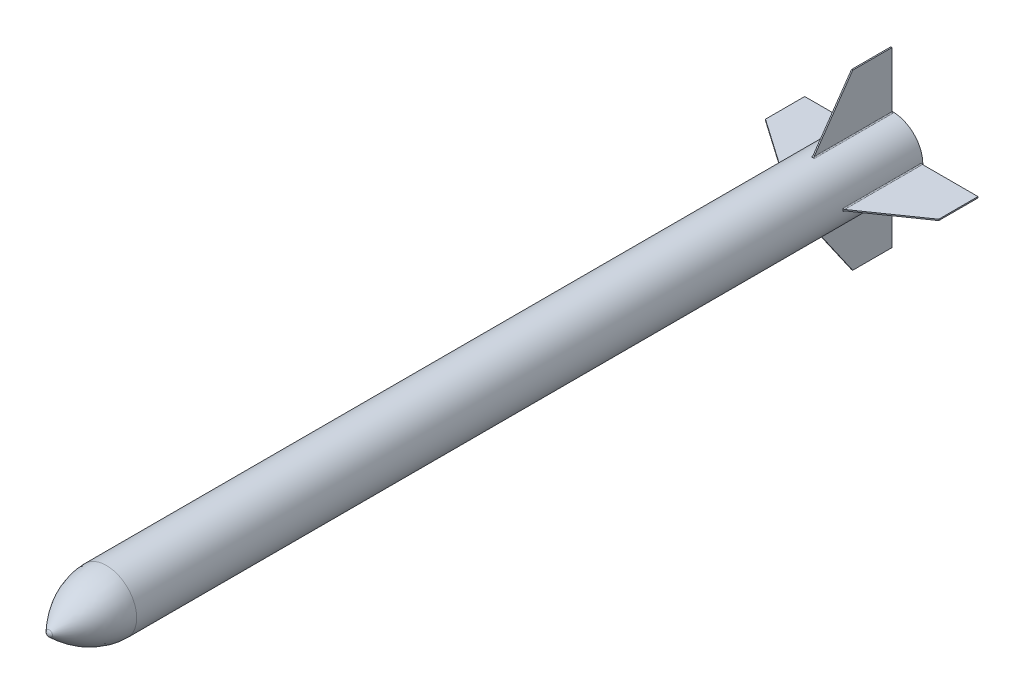
from build123d import *

# Parameters (mm, degrees)
SKETCH3_R                = 43.942
BOSS_EXTRUDE1_DEPTH      = 15.24
BOSS_EXTRUDE2_REACH      = 2235.699
BOSS_EXTRUDE2_END_RADIUS = 78.32293196
SKETCH4_W                = 3.175
SKETCH4_H                = 203.2
CUT_EXTRUDE1_REACH       = 2225.452
FILLET1_R                = 2.54
CIRPATTERN1_COUNT        = 4
FILLET1_OF_CIRPATTERN1_R = 2.54


with BuildPart() as part:
    # Sketch2 → Revolve1 (revolve)
    with BuildSketch(Plane(origin=(0, 0, 0), x_dir=(0, 0, -1), z_dir=(1, 0, 0))):
        with BuildLine():
            Line((156.718, 78.322932), (2192.2105, 78.322932))
            Line((2192.2105, 78.322932), (2192.2105, 4e-08))
            Line((2192.2105, 4e-08), (4.964740615, 4e-08))
            ThreePointArc((4.964740615, 4e-08), (5.897622526, 4.522765989), (8.543990278, 8.307263076))
            add(Edge.make_bspline(
                [(8.543990278, 8.307263076), (82.630995139, 78.322932), (156.718, 78.322932)],
                knots=[0.068626342, 0.068626342, 0.068626342, 0.915329667, 0.915329667, 0.915329667], degree=2))
        make_face()
    revolve(axis=Axis((0, 4e-08, -2192.2105), (0, 0, 1)))

    # Sketch3 → Boss-Extrude1 (add)
    with BuildSketch(Plane(origin=(0, 0, -2192.2105), x_dir=(-1, 0, 0), z_dir=(0, 0, -1))):
        with Locations(Location((0, 0, 0), (0, 0, 270))):
            Circle(SKETCH3_R)
    extrude(amount=BOSS_EXTRUDE1_DEPTH)

    # Boss-Extrude2: up to this cylinder (the profile starts outside it)
    boss_extrude2_end = Plane(origin=(0, 4e-08, -2087.4355), z_dir=(0, 0, -1)) * Cylinder(BOSS_EXTRUDE2_END_RADIUS, 4629.043863919, mode=Mode.PRIVATE)
    # Sketch4 → Boss-Extrude2 (add, up to the surface)
    with BuildSketch(Plane(origin=(0, 254, 0), x_dir=(1, 0, 0), z_dir=(0, 1, 0)), mode=Mode.PRIVATE) as boss_extrude2_sk1:
        with Locations((0, 2087.4355)):
            Rectangle(SKETCH4_W, SKETCH4_H)
    boss_extrude2_tool1 = extrude(boss_extrude2_sk1.sketch, amount=-BOSS_EXTRUDE2_REACH, mode=Mode.PRIVATE) - boss_extrude2_end
    boss_extrude2 = boss_extrude2_tool1.solids().sort_by_distance((0, 254, -2087.4355))[0]
    add(boss_extrude2)

    # Sketch5 → Cut-Extrude1 (cut, up to next)
    with BuildSketch(Plane.ZY.offset(1.5875), mode=Mode.PRIVATE) as cut_extrude1_sk1:
        Polygon((-2189.0355, 224.356842107), (-2087.4355, 224.356842107), (-1985.8355, 78.306842107), (-1985.8355, 254), (-2189.0355, 254), align=None)
    cut_extrude1_tool1 = extrude(cut_extrude1_sk1.sketch, amount=-CUT_EXTRUDE1_REACH, mode=Mode.PRIVATE) & part.part
    cut_extrude1 = cut_extrude1_tool1.solids().sort_by_distance((-1.5875, 204.128915, -2050.052252))[0]
    add(cut_extrude1, mode=Mode.SUBTRACT)

    # Fillet1
    # the kernel refuses this fillet: 2.54 mm, written as the material it adds along each edge
    with BuildSketch(Plane(origin=(-1.5875, 78.306842107, -1979.708797857), x_dir=(-0.9993639751492599, -0.03566013423796214, 0), z_dir=(0, 0, -1))) as fillet1_piece_1_section:
        with BuildLine():
            CenterArc((2.450992889, 2.539698904), FILLET1_R, 182.043608469, 87.074170623)
            Line((-0.087391608, 2.449122163), (0, 0))
            ThreePointArc((0, 0), (1.205942189, 0.009284527), (2.411884379, 0))
        make_face()
    fillet1_piece_1 = extrude(amount=209.326702143, mode=Mode.PRIVATE)
    fillet1_piece_1 = split(fillet1_piece_1, bisect_by=Plane(origin=(-3.095055571, 78.248638535, -1985.795010558), z_dir=(0, -0.5710644881985977, -0.8209052017854886)), keep=Keep.TOP, mode=Mode.PRIVATE)
    add(fillet1_piece_1)
    with BuildSketch(Plane(origin=(1.5875, 78.306842107, -1979.708797857), x_dir=(0.9993639751492599, -0.035660134237962375, 0), z_dir=(0, 0, -1))) as fillet1_piece_2_section:
        with BuildLine():
            CenterArc((2.450992889, -2.539698904), FILLET1_R, 90.882220908, 87.074170623)
            Line((-0.087391608, -2.449122163), (0, 0))
            ThreePointArc((0, 0), (1.205942189, -0.009284527), (2.411884379, 0))
        make_face()
    fillet1_piece_2 = extrude(amount=209.326702143, mode=Mode.PRIVATE)
    fillet1_piece_2 = split(fillet1_piece_2, bisect_by=Plane(origin=(3.095055571, 78.248638535, -1985.795010558), z_dir=(0, -0.5710644881985977, -0.8209052017854886)), keep=Keep.TOP, mode=Mode.PRIVATE)
    add(fillet1_piece_2)

    # CirPattern1: Boss-Extrude2, Cut-Extrude1 ×4 about axis
    cirpattern1_axis = Axis((0, 1.7e-08, 0), (0, 0, 1))
    add([boss_extrude2.rotate(cirpattern1_axis, i * 360 / CIRPATTERN1_COUNT) for i in range(1, CIRPATTERN1_COUNT)])
    add([cut_extrude1.rotate(cirpattern1_axis, i * 360 / CIRPATTERN1_COUNT) for i in range(1, CIRPATTERN1_COUNT)], mode=Mode.SUBTRACT)

    # Fillet1 of CirPattern1
    # the kernel refuses this fillet: 2.54 mm, written as the material it adds along each edge
    with BuildSketch(Plane(origin=(-78.306842067, -1.587499983, -1979.708797917), x_dir=(0.03566013452716192, -0.9993639751389404, 0), z_dir=(0, 0, -1))) as fillet1_of_cirpattern1_piece_1_section:
        with BuildLine():
            CenterArc((2.450992888, 2.539698904), FILLET1_OF_CIRPATTERN1_R, 182.043608486, 87.074170607)
            Line((-0.087391609, 2.449122163), (0, 0))
            ThreePointArc((0, 0), (1.205942189, 0.009284527), (2.411884378, 0))
        make_face()
    fillet1_of_cirpattern1_piece_1 = extrude(amount=209.326702083, mode=Mode.PRIVATE)
    fillet1_of_cirpattern1_piece_1 = split(fillet1_of_cirpattern1_piece_1, bisect_by=Plane(origin=(-78.248638505, -3.095055439, -1985.79501055), z_dir=(0.5710644881985977, 0, -0.8209052017854886)), keep=Keep.TOP, mode=Mode.PRIVATE)
    add(fillet1_of_cirpattern1_piece_1)
    with BuildSketch(Plane(origin=(-78.306842068, 1.587500017, -1979.708797911), x_dir=(0.03566013394875642, 0.9993639751595796, 0), z_dir=(0, 0, -1))) as fillet1_of_cirpattern1_piece_2_section:
        with BuildLine():
            CenterArc((2.450992889, -2.539698904), FILLET1_OF_CIRPATTERN1_R, 90.882220908, 87.074170639)
            Line((-0.087391608, -2.449122164), (0, 0))
            ThreePointArc((0, 0), (1.20594219, -0.009284527), (2.411884379, 0))
        make_face()
    fillet1_of_cirpattern1_piece_2 = extrude(amount=209.326702089, mode=Mode.PRIVATE)
    fillet1_of_cirpattern1_piece_2 = split(fillet1_of_cirpattern1_piece_2, bisect_by=Plane(origin=(-78.248638506, 3.095055478, -1985.79501055), z_dir=(0.5710644881985977, 0, -0.8209052017854886)), keep=Keep.TOP, mode=Mode.PRIVATE)
    add(fillet1_of_cirpattern1_piece_2)
    with BuildSketch(Plane(origin=(1.5875, -78.306842027, -1979.708797972), x_dir=(0.9993639751492599, 0.03566013423796238, 0), z_dir=(0, 0, -1))) as fillet1_of_cirpattern1_piece_3_section:
        with BuildLine():
            CenterArc((2.450992889, 2.539698904), FILLET1_OF_CIRPATTERN1_R, 182.043608469, 87.074170623)
            Line((-0.087391608, 2.449122163), (0, 0))
            ThreePointArc((0, 0), (1.205942189, 0.009284527), (2.411884379, 0))
        make_face()
    fillet1_of_cirpattern1_piece_3 = extrude(amount=209.326702028, mode=Mode.PRIVATE)
    fillet1_of_cirpattern1_piece_3 = split(fillet1_of_cirpattern1_piece_3, bisect_by=Plane(origin=(3.095055347, -78.248638477, -1985.795010542), z_dir=(0, 0.5710644881985977, -0.8209052017854886)), keep=Keep.TOP, mode=Mode.PRIVATE)
    add(fillet1_of_cirpattern1_piece_3)
    with BuildSketch(Plane(origin=(-1.5875, -78.306842027, -1979.708797972), x_dir=(-0.9993639751492599, 0.03566013423796186, 0), z_dir=(0, 0, -1))) as fillet1_of_cirpattern1_piece_4_section:
        with BuildLine():
            CenterArc((2.450992889, -2.539698904), FILLET1_OF_CIRPATTERN1_R, 90.882220908, 87.074170623)
            Line((-0.087391608, -2.449122163), (0, 0))
            ThreePointArc((0, 0), (1.205942189, -0.009284527), (2.411884379, 0))
        make_face()
    fillet1_of_cirpattern1_piece_4 = extrude(amount=209.326702028, mode=Mode.PRIVATE)
    fillet1_of_cirpattern1_piece_4 = split(fillet1_of_cirpattern1_piece_4, bisect_by=Plane(origin=(-3.095055347, -78.248638477, -1985.795010542), z_dir=(0, 0.5710644881985977, -0.8209052017854886)), keep=Keep.TOP, mode=Mode.PRIVATE)
    add(fillet1_of_cirpattern1_piece_4)
    with BuildSketch(Plane(origin=(78.306842068, 1.587500017, -1979.708797911), x_dir=(-0.03566013394876229, 0.9993639751595792, 0), z_dir=(0, 0, -1))) as fillet1_of_cirpattern1_piece_5_section:
        with BuildLine():
            CenterArc((2.450992889, 2.539698904), FILLET1_OF_CIRPATTERN1_R, 182.043608452, 87.074170639)
            Line((-0.087391608, 2.449122164), (0, 0))
            ThreePointArc((0, 0), (1.20594219, 0.009284527), (2.411884379, 0))
        make_face()
    fillet1_of_cirpattern1_piece_5 = extrude(amount=209.326702089, mode=Mode.PRIVATE)
    fillet1_of_cirpattern1_piece_5 = split(fillet1_of_cirpattern1_piece_5, bisect_by=Plane(origin=(78.248638506, 3.095055478, -1985.79501055), z_dir=(-0.5710644881985977, 0, -0.8209052017854886)), keep=Keep.TOP, mode=Mode.PRIVATE)
    add(fillet1_of_cirpattern1_piece_5)
    with BuildSketch(Plane(origin=(78.306842067, -1.587499983, -1979.708797917), x_dir=(-0.03566013452716244, -0.9993639751389404, 0), z_dir=(0, 0, -1))) as fillet1_of_cirpattern1_piece_6_section:
        with BuildLine():
            CenterArc((2.450992888, -2.539698904), FILLET1_OF_CIRPATTERN1_R, 90.882220908, 87.074170607)
            Line((-0.087391609, -2.449122163), (0, 0))
            ThreePointArc((0, 0), (1.205942189, -0.009284527), (2.411884378, 0))
        make_face()
    fillet1_of_cirpattern1_piece_6 = extrude(amount=209.326702083, mode=Mode.PRIVATE)
    fillet1_of_cirpattern1_piece_6 = split(fillet1_of_cirpattern1_piece_6, bisect_by=Plane(origin=(78.248638505, -3.095055439, -1985.79501055), z_dir=(-0.5710644881985977, 0, -0.8209052017854886)), keep=Keep.TOP, mode=Mode.PRIVATE)
    add(fillet1_of_cirpattern1_piece_6)


solid = part.part
